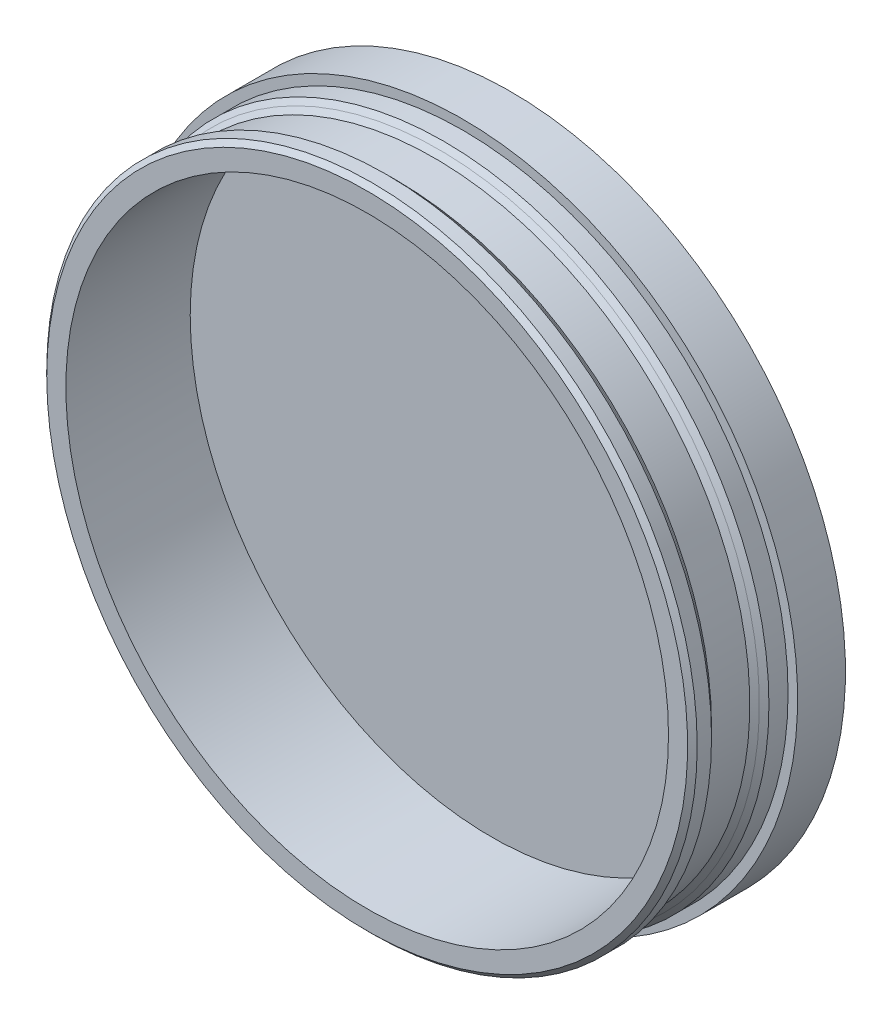
from build123d import *

# Parameters (mm, degrees)
CHAMFER1_SIZE           = 0.5
CHAMFER2_SIZE           = 0.5
BOSS_EXTRUDE1_START     = -2
SKETCH3_R               = 28.025
BOSS_EXTRUDE1_DEPTH     = 2
CUT_EXTRUDE1_DEPTH      = 54.38539126
CUT_EXTRUDE1_DEPTH_BACK = 54.38539126
SKETCH4_W               = 71.155629785
SKETCH4_H               = 10.339888571
SKETCH5_R               = 31.5
CUT_EXTRUDE2_DEPTH      = 13


with BuildPart() as part:
    # Sketch1 → Revolve1 (revolve)
    with BuildSketch(Plane(origin=(0, 0, 0), x_dir=(1, 0, 0), z_dir=(0, 1, 0)), mode=Mode.PRIVATE) as revolve1_sk:
        Polygon((25.025, 0), (25.025, 20), (28.025, 20), (28.025, 15), (35, 15), (35, 10), (34, 10), (34, 7.5), (33, 7.5), (33, 2.5), (34, 2.5), (34, 0), align=None)
    revolve(revolve1_sk.sketch.rotate(Axis((0, 0, -99.297916667), (0, 0, 1)), 180), axis=Axis((0, 0, -99.297916667), (0, 0, 1)))

    # Chamfer1
    chamfer1_edges = [part.edges().sort_by_distance(p)[0] for p in [
        (28.025, 0, -20),
        (25.025, 0, -20),
    ]]
    chamfer(chamfer1_edges, length=CHAMFER1_SIZE)

    # Chamfer2
    chamfer2_edges = [part.edges().sort_by_distance(p)[0] for p in [
        (34, 0, -7.5),
        (34, 0, 0),
        (34, 0, -2.5),
        (33, 0, -2.5),
        (33, 0, -7.5),
    ]]
    chamfer(chamfer2_edges, length=CHAMFER2_SIZE - 0.0001)  # a hair under: the kernel refuses the full size

    # Sketch3 → Boss-Extrude1 (add)
    with BuildSketch(Plane(origin=(0, 0, -15), x_dir=(-1, 0, 0), z_dir=(0, 0, -1)).offset(BOSS_EXTRUDE1_START)):
        Circle(SKETCH3_R)
    extrude(amount=BOSS_EXTRUDE1_DEPTH)

    # Sketch4 → Cut-Extrude1 (cut, two sides: drawn at the far end of the back side and taken through both)
    with BuildSketch(Plane(origin=(0, 0, 0), x_dir=(1, 0, 0), z_dir=(0, 1, 0)).offset(-CUT_EXTRUDE1_DEPTH_BACK)):
        with Locations((0.577814893, 20.169944286)):
            Rectangle(SKETCH4_W, SKETCH4_H)
    extrude(amount=CUT_EXTRUDE1_DEPTH + CUT_EXTRUDE1_DEPTH_BACK, mode=Mode.SUBTRACT)

    # Sketch5 → Cut-Extrude2 (cut)
    with BuildSketch(Plane.XY):
        Circle(SKETCH5_R)
    extrude(amount=-CUT_EXTRUDE2_DEPTH, mode=Mode.SUBTRACT)


solid = part.part
